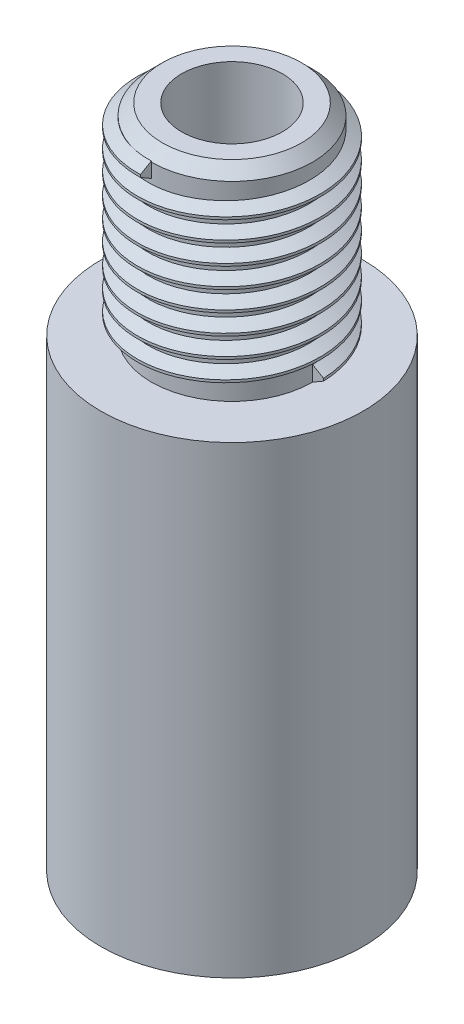
from build123d import *

# Parameters (mm, degrees)
SKETCH1_R               = 6.5
BOSS_EXTRUDE1_DEPTH     = 23
SKETCH2_R               = 4
BOSS_EXTRUDE2_DEPTH     = 10
CUT_EXTRUDE1_DEPTH      = 35.256386266
CUT_EXTRUDE1_DEPTH_BACK = 35.256386266
SKETCH3_R               = 2.5
CUT_EXTRUDE2_DEPTH      = 35.256386266
CUT_EXTRUDE2_DEPTH_BACK = 18
SKETCH4_R               = 4.5
CHAMFER1_SIZE           = 0.55
THREAD1_PITCH           = 1


with BuildPart() as part:
    # Sketch1 → Boss-Extrude1 (new body)
    with BuildSketch(Plane(origin=(0, 0, 0), x_dir=(1, 0, 0), z_dir=(0, 1, 0))):
        with Locations(Location((0, 0, 0), (0, 0, 270))):
            Circle(SKETCH1_R)
    extrude(amount=BOSS_EXTRUDE1_DEPTH)

    # Sketch2 → Boss-Extrude2 (add)
    with BuildSketch(Plane(origin=(0, 23, 0), x_dir=(1, 0, 0), z_dir=(0, 1, 0))):
        with Locations(Location((0, 0, 0), (0, 0, 270))):
            Circle(SKETCH2_R)
    extrude(amount=BOSS_EXTRUDE2_DEPTH)

    # Sketch3 → Cut-Extrude1 (cut, two sides: drawn at the far end of the back side and taken through both)
    with BuildSketch(Plane.XZ.offset(-CUT_EXTRUDE1_DEPTH_BACK)):
        with Locations(Location((0, 0, 0), (0, 0, 270))):
            Circle(SKETCH3_R)
    extrude(amount=CUT_EXTRUDE1_DEPTH + CUT_EXTRUDE1_DEPTH_BACK, mode=Mode.SUBTRACT)

    # Sketch4 → Cut-Extrude2 (cut, two sides: drawn at the far end of the back side and taken through both)
    with BuildSketch(Plane.XZ.offset(-CUT_EXTRUDE2_DEPTH_BACK)):
        with Locations(Location((0, 0, 0), (0, 0, 90))):
            Circle(SKETCH4_R)
    extrude(amount=CUT_EXTRUDE2_DEPTH + CUT_EXTRUDE2_DEPTH_BACK, mode=Mode.SUBTRACT)

    # Chamfer1
    chamfer1_edges = [part.edges().sort_by_distance(p)[0] for p in [
        (0, 33, -4),
    ]]
    chamfer(chamfer1_edges, length=CHAMFER1_SIZE)

    # Thread1: the profile of Thread Profile2 profile screwed along a right-hand helix of 8.75 turns, 8 arcs to a turn; built about Z, then put on its axis
    thread1_z = Axis((0, 0, 0), (0, 0, 1))
    thread1_corners = [(3.9997, 0, -0.000173205), (4.541265875, 0, 0.312499999), (4.541265875, 0, 0.437499999), (3.9997, 0, 0.750173202)]
    with BuildLine(mode=Mode.PRIVATE) as thread1_profile:
        Line(thread1_corners[0], thread1_corners[1])
        Line(thread1_corners[1], thread1_corners[2])
        Line(thread1_corners[2], thread1_corners[3])
        Line(thread1_corners[3], thread1_corners[0])
    thread1_cap = Face(thread1_profile.wire())
    thread1_turn_angles = [0, 22.5, 45, 67.5, 90, 112.5, 135, 157.5, 180, 202.5, 225, 247.5, 270, 292.5, 315, 337.5, 360]
    thread1_turn_weights = [1, 0.9238795325112867, 1, 0.9238795325112867, 1, 0.9238795325112867, 1, 0.9238795325112867, 1, 0.9238795325112867, 1, 0.9238795325112867, 1, 0.9238795325112867, 1, 0.9238795325112867, 1]
    thread1_turn_rails = [Edge.make_bspline([Vector(p[0], p[1], 0).rotate(thread1_z, thread1_turn_angles[k]) / thread1_turn_weights[k] + Vector(0, 0, p[2] + THREAD1_PITCH * thread1_turn_angles[k] / 360) for k in range(17)], [0, 0, 0, 1, 1, 2, 2, 3, 3, 4, 4, 5, 5, 6, 6, 7, 7, 8, 8, 8], 2, thread1_turn_weights) for p in thread1_corners]
    thread1_turn_sides = [Face.make_surface_from_curves(thread1_turn_rails[p[0]], thread1_turn_rails[p[1]]) for p in [(0, 1), (1, 2), (2, 3), (3, 0)]]
    thread1_last_angles = [2880, 2902.5, 2925, 2947.5, 2970, 2992.5, 3015, 3037.5, 3060, 3082.5, 3105, 3127.5, 3150]
    thread1_last_weights = [1, 0.9238795325112867, 1, 0.9238795325112867, 1, 0.9238795325112867, 1, 0.9238795325112867, 1, 0.9238795325112867, 1, 0.9238795325112867, 1]
    thread1_last_rails = [Edge.make_bspline([Vector(p[0], p[1], 0).rotate(thread1_z, thread1_last_angles[k]) / thread1_last_weights[k] + Vector(0, 0, p[2] + THREAD1_PITCH * thread1_last_angles[k] / 360) for k in range(13)], [0, 0, 0, 1, 1, 2, 2, 3, 3, 4, 4, 5, 5, 6, 6, 6], 2, thread1_last_weights) for p in thread1_corners]
    thread1_last_sides = [Face.make_surface_from_curves(thread1_last_rails[p[0]], thread1_last_rails[p[1]]) for p in [(0, 1), (1, 2), (2, 3), (3, 0)]]
    thread1 = Plane(origin=(0, 23, 0), x_dir=(1, 0, 0), z_dir=(0, 1, 0)) * Solid(Shell([*[p.moved(Location((0, 0, THREAD1_PITCH * i))) for i in range(8) for p in thread1_turn_sides], *thread1_last_sides, thread1_cap, thread1_cap.rotate(thread1_z, 3150).moved(Location((0, 0, THREAD1_PITCH * 3150 / 360)))]))
    add(thread1)


solid = part.part
